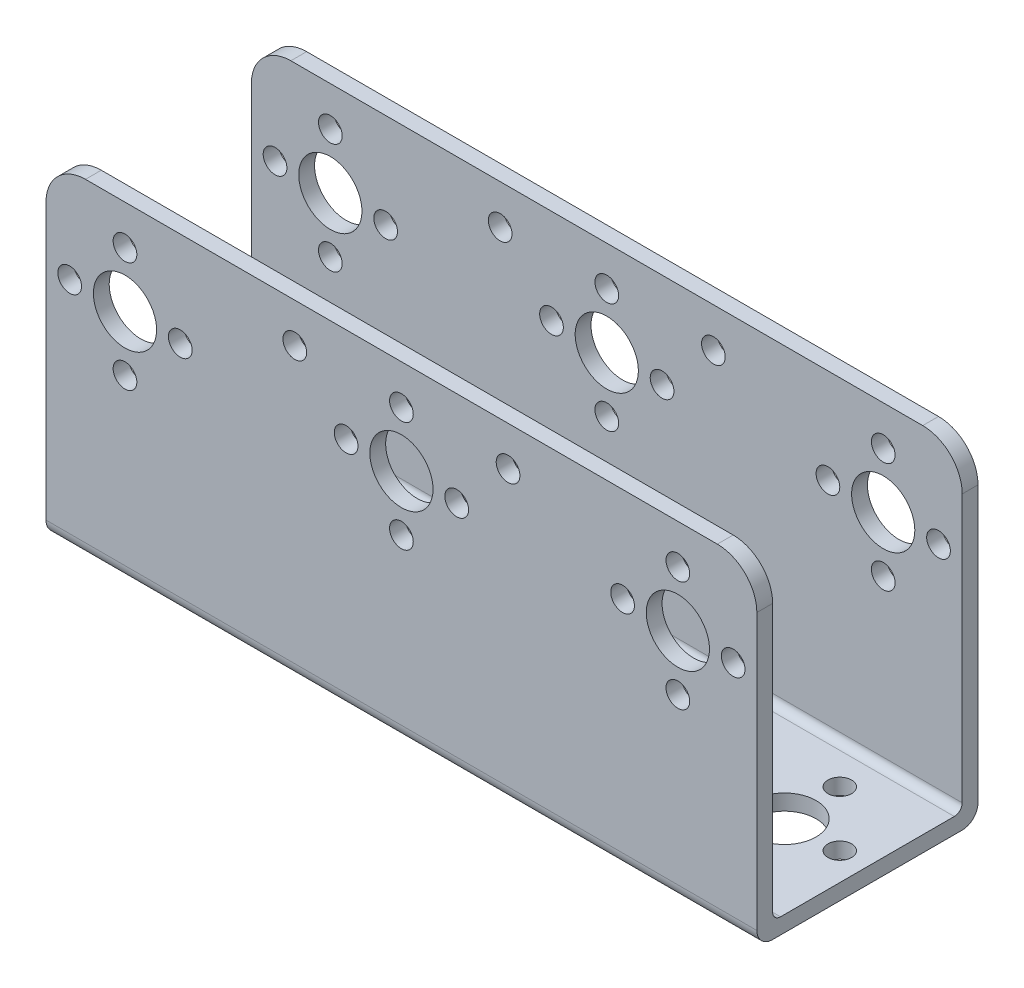
from build123d import *

# Parameters (mm, degrees)
ESTRUSIONE_ESTRUSIONE1_DEPTH = 2
SCHIZZO2_W                   = 90
SCHIZZO2_H                   = 28
ESTRUSIONE_ESTRUSIONE2_DEPTH = 2
ESTRUSIONE_ESTRUSIONE3_START = 2
ESTRUSIONE_ESTRUSIONE3_DEPTH = 2
SCHIZZO5_R                   = 4
SCHIZZO5_R_2                 = 1.5
TAGLIO_ESTRUSIONE1_DEPTH     = 104.132432046
RACCORDO1_R                  = 2
RACCORDO2_R                  = 2
RACCORDO3_R                  = 1
RACCORDO4_R                  = 1
SCHIZZO6_R                   = 4
SCHIZZO6_R_2                 = 1.5
TAGLIO_ESTRUSIONE2_DEPTH     = 104.132432046
CUT_EXTRUDE1_DEPTH           = 104.132432046
CUT_EXTRUDE1_DEPTH_BACK      = 104.132432046
SKETCH1_R                    = 1.5


with BuildPart() as part:
    # Schizzo1 → Estrusione-Estrusione1 (new body)
    with BuildSketch(Plane.XY):
        with BuildLine():
            Line((0, 0), (90, 0))
            Line((90, 0), (90, 36.860465116))
            ThreePointArc((90, 36.860465116), (88.535533906, 40.395999022), (85, 41.860465116))
            Line((85, 41.860465116), (5, 41.860465116))
            ThreePointArc((5, 41.860465116), (1.464466094, 40.395999022), (0, 36.860465116))
            Line((0, 36.860465116), (0, 0))
        make_face()
    extrude(amount=-ESTRUSIONE_ESTRUSIONE1_DEPTH)

    # Schizzo2 → Estrusione-Estrusione2 (add)
    with BuildSketch(Plane(origin=(0, 0, 0), x_dir=(1, 0, 0), z_dir=(0, 1, 0))):
        with Locations((45, 14)):
            Rectangle(SCHIZZO2_W, SCHIZZO2_H)
    extrude(amount=ESTRUSIONE_ESTRUSIONE2_DEPTH)

    # Schizzo4 → Estrusione-Estrusione3 (add)
    with BuildSketch(Plane.XY.offset(-28).offset(ESTRUSIONE_ESTRUSIONE3_START)):
        with BuildLine():
            Line((90, 0), (90, 36.860465116))
            ThreePointArc((90, 36.860465116), (88.535533906, 40.395999022), (85, 41.860465116))
            Line((85, 41.860465116), (5, 41.860465116))
            ThreePointArc((5, 41.860465116), (1.464466094, 40.395999022), (0, 36.860465116))
            Line((0, 36.860465116), (0, 0))
            Line((0, 0), (90, 0))
        make_face()
    extrude(amount=-ESTRUSIONE_ESTRUSIONE3_DEPTH)

    # Schizzo5 → Taglio-Estrusione1 (cut, through all)
    with BuildSketch(Plane.XY):
        with Locations((10, 29.860465116)):
            Circle(SCHIZZO5_R)
        with Locations((45, 29.860465116)):
            Circle(SCHIZZO5_R)
        with Locations((80, 29.860465116)):
            Circle(SCHIZZO5_R)
        with Locations((10, 36.860465116)):
            Circle(SCHIZZO5_R_2)
        with Locations((3, 29.860465116)):
            Circle(SCHIZZO5_R_2)
        with Locations((10, 22.860465116)):
            Circle(SCHIZZO5_R_2)
        with Locations((17, 29.860465116)):
            Circle(SCHIZZO5_R_2)
        with Locations((38, 29.860465116)):
            Circle(SCHIZZO5_R_2)
        with Locations((45, 36.860465116)):
            Circle(SCHIZZO5_R_2)
        with Locations((80, 36.860465116)):
            Circle(SCHIZZO5_R_2)
        with Locations((73, 29.860465116)):
            Circle(SCHIZZO5_R_2)
        with Locations((45, 22.860465116)):
            Circle(SCHIZZO5_R_2)
        with Locations((80, 22.860465116)):
            Circle(SCHIZZO5_R_2)
        with Locations((87, 29.860465116)):
            Circle(SCHIZZO5_R_2)
        with Locations((52, 29.860465116)):
            Circle(SCHIZZO5_R_2)
    extrude(amount=-TAGLIO_ESTRUSIONE1_DEPTH, mode=Mode.SUBTRACT)

    # Raccordo1
    raccordo1_edges = [part.edges().sort_by_distance(p)[0] for p in [
        (45, 0, -28),
    ]]
    fillet(raccordo1_edges, radius=RACCORDO1_R)

    # Raccordo2
    raccordo2_edges = [part.edges().sort_by_distance(p)[0] for p in [
        (45, 0, 0),
    ]]
    fillet(raccordo2_edges, radius=RACCORDO2_R)

    # Raccordo3
    raccordo3_edges = [part.edges().sort_by_distance(p)[0] for p in [
        (45, 2, -2),
    ]]
    fillet(raccordo3_edges, radius=RACCORDO3_R)

    # Raccordo4
    raccordo4_edges = [part.edges().sort_by_distance(p)[0] for p in [
        (45, 2, -26),
    ]]
    fillet(raccordo4_edges, radius=RACCORDO4_R)

    # Schizzo6 → Taglio-Estrusione2 (cut, through all)
    with BuildSketch(Plane(origin=(0, 0, 0), x_dir=(1, 0, 0), z_dir=(0, 1, 0))):
        with Locations((45, 14)):
            Circle(SCHIZZO6_R)
        with Locations((10.5, 14)):
            Circle(SCHIZZO6_R)
        with Locations((79.5, 14)):
            Circle(SCHIZZO6_R)
        with Locations((10.5, 21)):
            Circle(SCHIZZO6_R_2)
        with Locations((3.5, 14)):
            Circle(SCHIZZO6_R_2)
        with Locations((10.5, 7)):
            Circle(SCHIZZO6_R_2)
        with Locations((17.5, 14)):
            Circle(SCHIZZO6_R_2)
        with Locations((38, 14)):
            Circle(SCHIZZO6_R_2)
        with Locations((45, 21)):
            Circle(SCHIZZO6_R_2)
        with Locations((79.5, 21)):
            Circle(SCHIZZO6_R_2)
        with Locations((79.5, 7)):
            Circle(SCHIZZO6_R_2)
        with Locations((45, 7)):
            Circle(SCHIZZO6_R_2)
        with Locations((52, 14)):
            Circle(SCHIZZO6_R_2)
        with Locations((86.5, 14)):
            Circle(SCHIZZO6_R_2)
        with Locations((72.5, 14)):
            Circle(SCHIZZO6_R_2)
    extrude(amount=TAGLIO_ESTRUSIONE2_DEPTH, mode=Mode.SUBTRACT)

    # Sketch1 → Cut-Extrude1 (cut, two sides: drawn at the far end of the back side and taken through both)
    with BuildSketch(Plane.XY.offset(-CUT_EXTRUDE1_DEPTH_BACK)):
        with Locations((31.5, 36.860465116)):
            Circle(SKETCH1_R)
        with Locations((58.5, 36.860465116)):
            Circle(SKETCH1_R)
    extrude(amount=CUT_EXTRUDE1_DEPTH + CUT_EXTRUDE1_DEPTH_BACK, mode=Mode.SUBTRACT)


solid = part.part
